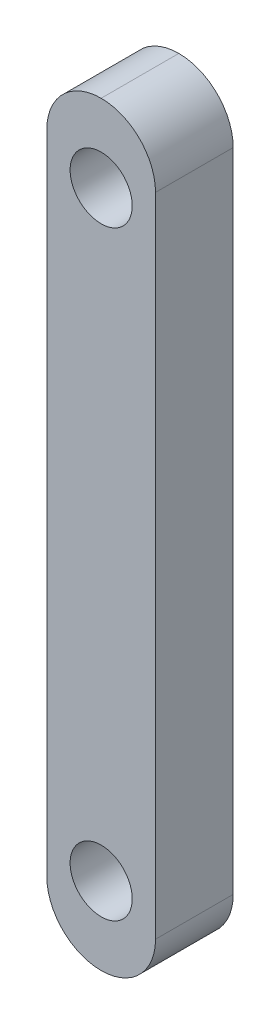
from build123d import *

# Parameters (mm, degrees)
BOSS_EXTRUDE1_DEPTH = 5
FILLET1_R           = 3.5


with BuildPart() as part:
    # Sketch1 → Boss-Extrude1 (new body)
    with BuildSketch(Plane.XY):
        with BuildLine():
            Line((0, -21.32), (0, -24.32))
            Line((0, -24.32), (3.5, -24.32))
            Line((3.5, -24.32), (3.5, 24.32))
            Line((3.5, 24.32), (0, 24.32))
            Line((0, 24.32), (0, 21.32))
            ThreePointArc((0, 21.32), (1.414213562, 20.734213562), (2, 19.32))
            ThreePointArc((2, 19.32), (1.414213562, 17.905786438), (0, 17.32))
            Line((0, 17.32), (0, -17.32))
            ThreePointArc((0, -17.32), (1.414213562, -17.905786438), (2, -19.32))
            ThreePointArc((2, -19.32), (1.414213562, -20.734213562), (0, -21.32))
        make_face()
        with BuildLine():
            Line((-3.5, -24.32), (0, -24.32))
            Line((0, -24.32), (0, -21.32))
            ThreePointArc((0, -21.32), (-2, -19.32), (0, -17.32))
            Line((0, -17.32), (0, 17.32))
            ThreePointArc((0, 17.32), (-2, 19.32), (0, 21.32))
            Line((0, 21.32), (0, 24.32))
            Line((0, 24.32), (-3.5, 24.32))
            Line((-3.5, 24.32), (-3.5, -24.32))
        make_face()
    extrude(amount=BOSS_EXTRUDE1_DEPTH)

    # Fillet1
    fillet1_edges = [part.edges().sort_by_distance(p)[0] for p in [
        (-3.5, 24.32, 2.5),
        (3.5, 24.32, 2.5),
        (-3.5, -24.32, 2.5),
        (3.5, -24.32, 2.5),
    ]]
    fillet(fillet1_edges, radius=FILLET1_R - 0.0001)  # a hair under: the kernel refuses the full size


solid = part.part
